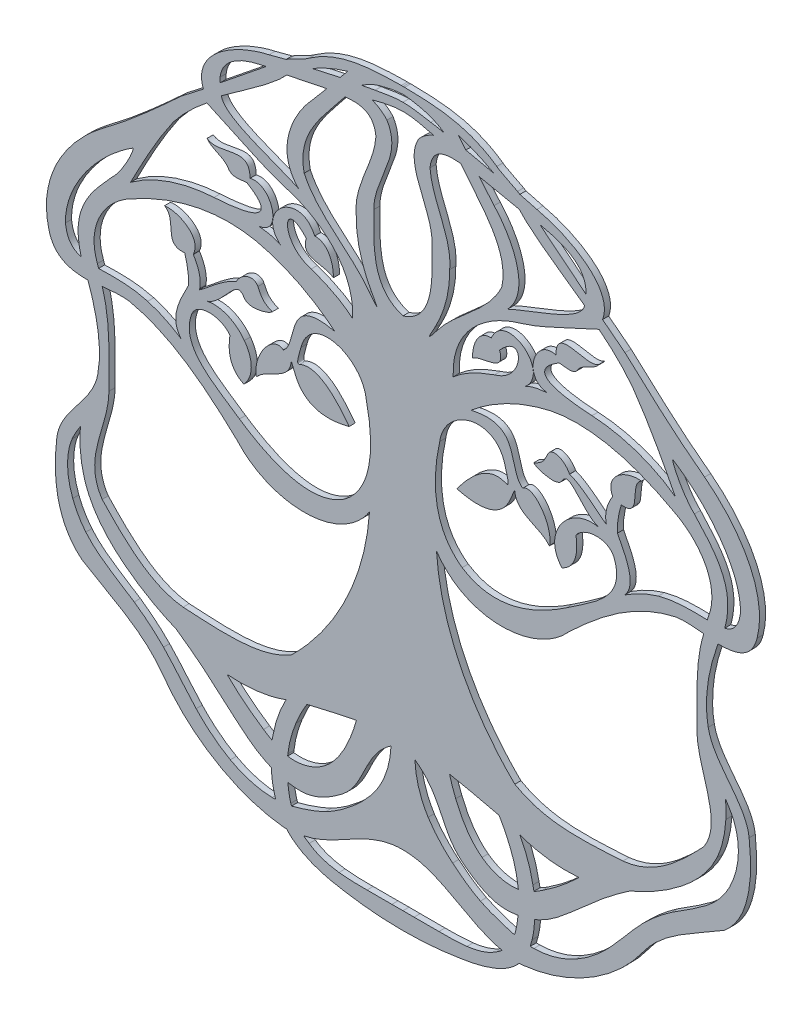
from build123d import *

# Parameters (mm, degrees)
BOSS_EXTRUDE7_DEPTH = 2.54


with BuildPart() as part:
    # Sketch2 → Boss-Extrude7 (new body)
    with BuildSketch(Plane.XY):
        with BuildLine():
            Line((152.3000002, 304.769901), (151.6257826, 304.818034))
            add(Edge.make_bspline(
                [(113.3331744, 295.5002472), (124.9781092, 303.831371), (137.6751374, 304.6500384), (151.6257826, 304.818034)],
                knots=[0, 0, 0, 0, 1, 1, 1, 1], degree=3))
            add(Edge.make_bspline(
                [(104.722295, 290.8366294), (107.5512962, 292.465125), (111.5847908, 294.1033234), (113.3331744, 295.5002472)],
                knots=[0, 0, 0, 0, 1, 1, 1, 1], degree=3))
            add(Edge.make_bspline(
                [(103.7401786, 290.2368338), (103.8863556, 290.327207), (104.3898598, 290.6452658), (104.722295, 290.8366294)],
                knots=[0, 0, 0, 0, 1, 1, 1, 1], degree=3))
            add(Edge.make_bspline(
                [(96.6659738, 288.367978), (98.9349558, 288.8485714), (101.2604274, 289.7002842), (103.7401786, 290.2368338)],
                knots=[0, 0, 0, 0, 1, 1, 1, 1], degree=3))
            add(Edge.make_bspline(
                [(69.3754518, 262.3802728), (64.5839196, 275.4394288), (83.7947524, 285.6417198), (96.6659738, 288.367978)],
                knots=[0, 0, 0, 0, 1, 1, 1, 1], degree=3))
            add(Edge.make_bspline(
                [(60.0736924, 255.1498326), (63.058421, 257.6132008), (66.2000454, 259.7648094), (69.3754518, 262.3802728)],
                knots=[0, 0, 0, 0, 1, 1, 1, 1], degree=3))
            add(Edge.make_bspline(
                [(27.0060166, 226.9131098), (38.7004052, 235.5524626), (49.4139982, 245.3115236), (60.0736924, 255.1498326)],
                knots=[0, 0, 0, 0, 1, 1, 1, 1], degree=3))
            add(Edge.make_bspline(
                [(5.198618, 179.7975576), (0.476758, 198.246746), (12.9431542, 216.1660142), (27.0060166, 226.9131098)],
                knots=[0, 0, 0, 0, 1, 1, 1, 1], degree=3))
            add(Edge.make_bspline(
                [(21.4404956, 169.6735494), (14.0928852, 169.618787), (7.3094342, 171.153836), (5.198618, 179.7975576)],
                knots=[0, 0, 0, 0, 1, 1, 1, 1], degree=3))
            add(Edge.make_bspline(
                [(25.49017, 137.6539538), (27.4821904, 148.226145), (25.11425, 159.3330316), (21.4404956, 169.6735494)],
                knots=[0, 0, 0, 0, 1, 1, 1, 1], degree=3))
            add(Edge.make_bspline(
                [(8.4785454, 106.3868586), (9.8627184, 118.17096), (23.2931716, 125.994033), (25.49017, 137.6539538)],
                knots=[0, 0, 0, 0, 1, 1, 1, 1], degree=3))
            add(Edge.make_bspline(
                [(18.9078616, 67.8699684), (7.7220826, 76.9854188), (6.926834, 93.1763694), (8.4785454, 106.3868586)],
                knots=[0, 0, 0, 0, 1, 1, 1, 1], degree=3))
            add(Edge.make_bspline(
                [(52.6722086, 43.0965102), (44.261278, 55.0397426), (30.7505354, 60.4837246), (18.9078616, 67.8699684)],
                knots=[0, 0, 0, 0, 1, 1, 1, 1], degree=3))
            add(Edge.make_bspline(
                [(102.368858, 13.5532368), (83.2085966, 15.6220668), (64.1308598, 27.03576), (52.6722086, 43.0965102)],
                knots=[0, 0, 0, 0, 1, 1, 1, 1], degree=3))
            add(Edge.make_bspline(
                [(103.9590504, 13.5029448), (103.463852, 13.5462264), (102.8532868, 13.5009382), (102.368858, 13.5532368)],
                knots=[0, 0, 0, 0, 1, 1, 1, 1], degree=3))
            add(Edge.make_bspline(
                [(114.5072132, 6.4857884), (110.491397, 8.1114138), (106.7891184, 10.2032308), (103.9590504, 13.5029448)],
                knots=[0, 0, 0, 0, 1, 1, 1, 1], degree=3))
            add(Edge.make_bspline(
                [(128.2229084, 3.042793), (123.5579444, 3.7879782), (118.8861732, 4.7131732), (114.5072132, 6.4857884)],
                knots=[0, 0, 0, 0, 1, 1, 1, 1], degree=3))
            add(Edge.make_bspline(
                [(143.3041584, 1.3230098), (138.252581, 1.6410686), (133.2211458, 2.2443694), (128.2229084, 3.042793)],
                knots=[0, 0, 0, 0, 1, 1, 1, 1], degree=3))
            add(Edge.make_bspline(
                [(152.3000002, 1.0541762), (149.358731, 1.052195), (146.2599056, 1.1369802), (143.3041584, 1.3230098)],
                knots=[0, 0, 0, 0, 1, 1, 1, 1], degree=3))
            add(Edge.make_bspline(
                [(161.2958166, 1.3230098), (158.3400948, 1.1369294), (155.2412694, 1.0524998), (152.3000002, 1.0541762)],
                knots=[0, 0, 0, 0, 1, 1, 1, 1], degree=3))
            add(Edge.make_bspline(
                [(176.3770666, 3.042793), (171.3788546, 2.2443694), (166.3474194, 1.6410686), (161.2958166, 1.3230098)],
                knots=[0, 0, 0, 0, 1, 1, 1, 1], degree=3))
            add(Edge.make_bspline(
                [(190.0927618, 6.4857884), (185.7138272, 4.7131732), (181.042056, 3.7879782), (176.3770666, 3.042793)],
                knots=[0, 0, 0, 0, 1, 1, 1, 1], degree=3))
            add(Edge.make_bspline(
                [(200.6409246, 13.5029448), (197.810882, 10.2032308), (194.1086034, 8.1114138), (190.0927618, 6.4857884)],
                knots=[0, 0, 0, 0, 1, 1, 1, 1], degree=3))
            add(Edge.make_bspline(
                [(202.2311424, 13.5532368), (201.7466882, 13.5009382), (201.136123, 13.5462264), (200.6409246, 13.5029448)],
                knots=[0, 0, 0, 0, 1, 1, 1, 1], degree=3))
            add(Edge.make_bspline(
                [(251.9277664, 43.0965102), (240.4691406, 27.03576), (221.3914038, 15.6220668), (202.2311424, 13.5532368)],
                knots=[0, 0, 0, 0, 1, 1, 1, 1], degree=3))
            add(Edge.make_bspline(
                [(285.6921388, 67.8699684), (273.8494396, 60.4837246), (260.338697, 55.0397426), (251.9277664, 43.0965102)],
                knots=[0, 0, 0, 0, 1, 1, 1, 1], degree=3))
            add(Edge.make_bspline(
                [(296.1214296, 106.3868586), (297.6731664, 93.1763694), (296.8778924, 76.9854188), (285.6921388, 67.8699684)],
                knots=[0, 0, 0, 0, 1, 1, 1, 1], degree=3))
            add(Edge.make_bspline(
                [(279.1098304, 137.6539538), (281.3068034, 125.994033), (294.737282, 118.17096), (296.1214296, 106.3868586)],
                knots=[0, 0, 0, 0, 1, 1, 1, 1], degree=3))
            add(Edge.make_bspline(
                [(283.1594794, 169.6735494), (279.4857504, 159.3330316), (277.11781, 148.226145), (279.1098304, 137.6539538)],
                knots=[0, 0, 0, 0, 1, 1, 1, 1], degree=3))
            add(Edge.make_bspline(
                [(299.4013824, 179.7975576), (297.2905408, 171.153836), (290.5070898, 169.618787), (283.1594794, 169.6735494)],
                knots=[0, 0, 0, 0, 1, 1, 1, 1], degree=3))
            add(Edge.make_bspline(
                [(277.5939838, 226.9131098), (291.6568208, 216.1660142), (304.1232424, 198.246746), (299.4013824, 179.7975576)],
                knots=[0, 0, 0, 0, 1, 1, 1, 1], degree=3))
            add(Edge.make_bspline(
                [(244.526308, 255.1498326), (255.1859768, 245.3115236), (265.8995698, 235.5524626), (277.5939838, 226.9131098)],
                knots=[0, 0, 0, 0, 1, 1, 1, 1], degree=3))
            add(Edge.make_bspline(
                [(235.2245232, 262.3802728), (238.399955, 259.7648094), (241.541554, 257.6132008), (244.526308, 255.1498326)],
                knots=[0, 0, 0, 0, 1, 1, 1, 1], degree=3))
            add(Edge.make_bspline(
                [(207.9340012, 288.367978), (220.8052226, 285.6417198), (240.0160554, 275.4394288), (235.2245232, 262.3802728)],
                knots=[0, 0, 0, 0, 1, 1, 1, 1], degree=3))
            add(Edge.make_bspline(
                [(200.8597964, 290.2368338), (203.339573, 289.7002842), (205.6650192, 288.8485714), (207.9340012, 288.367978)],
                knots=[0, 0, 0, 0, 1, 1, 1, 1], degree=3))
            add(Edge.make_bspline(
                [(199.87768, 290.8366294), (200.2101406, 290.6452658), (200.7136448, 290.327207), (200.8597964, 290.2368338)],
                knots=[0, 0, 0, 0, 1, 1, 1, 1], degree=3))
            add(Edge.make_bspline(
                [(191.2668006, 295.5002472), (193.0151842, 294.1033234), (197.0487042, 292.465125), (199.87768, 290.8366294)],
                knots=[0, 0, 0, 0, 1, 1, 1, 1], degree=3))
            add(Edge.make_bspline(
                [(152.9741924, 304.818034), (166.924863, 304.6500384), (179.6218658, 303.831371), (191.2668006, 295.5002472)],
                knots=[0, 0, 0, 0, 1, 1, 1, 1], degree=3))
            Line((152.9741924, 304.818034), (152.3000002, 304.769901))
        make_face()
        with BuildLine():
            add(Edge.make_bspline(
                [(18.354675, 115.5237212), (18.057495, 113.2715032), (18.0132228, 110.7047316), (18.1562502, 108.1484248)],
                knots=[0, 0, 0, 0, 1, 1, 1, 1], degree=3))
            add(Edge.make_bspline(
                [(18.1562502, 108.1484248), (18.456783, 102.7768836), (19.6001894, 97.4201506), (21.8604084, 92.5380166)],
                knots=[0, 0, 0, 0, 1, 1, 1, 1], degree=3))
            add(Edge.make_bspline(
                [(21.8604084, 92.5380166), (25.0727972, 85.59927), (30.4308256, 79.838423), (36.4125002, 75.0755166)],
                knots=[0, 0, 0, 0, 1, 1, 1, 1], degree=3))
            add(Edge.make_bspline(
                [(36.4125002, 75.0755166), (42.9606964, 69.8615062), (50.325528, 65.7178772), (58.0619108, 62.4519198)],
                knots=[0, 0, 0, 0, 1, 1, 1, 1], degree=3))
            add(Edge.make_bspline(
                [(58.0619108, 62.4519198), (61.9791496, 59.781821), (65.7581108, 56.9600588), (69.4034426, 53.9750762)],
                knots=[0, 0, 0, 0, 1, 1, 1, 1], degree=3))
            add(Edge.make_bspline(
                [(69.4034426, 53.9750762), (73.9699562, 50.235739), (78.3226272, 46.2440528), (82.7802764, 42.375582)],
                knots=[0, 0, 0, 0, 1, 1, 1, 1], degree=3))
            add(Edge.make_bspline(
                [(82.7802764, 42.375582), (86.6647746, 39.0045194), (90.6804892, 35.6931722), (95.3066166, 33.4454246)],
                knots=[0, 0, 0, 0, 1, 1, 1, 1], degree=3))
            add(Edge.make_bspline(
                [(95.3066166, 33.4454246), (96.016953, 33.1002894), (96.7441042, 32.757872), (97.582355, 32.4747128)],
                knots=[0, 0, 0, 0, 1, 1, 1, 1], degree=3))
            add(Edge.make_bspline(
                [(97.582355, 32.4747128), (97.6805768, 29.7320462), (98.0484958, 27.128597), (98.6556828, 24.6063262)],
                knots=[0, 0, 0, 0, 1, 1, 1, 1], degree=3))
            add(Edge.make_bspline(
                [(98.6556828, 24.6063262), (98.8530916, 23.7862364), (99.1465886, 22.8141276), (99.431475, 21.844)],
                knots=[0, 0, 0, 0, 1, 1, 1, 1], degree=3))
            add(Edge.make_bspline(
                [(99.431475, 21.844), (98.9610162, 21.8112086), (98.4074994, 21.82241), (97.9281252, 21.8283028)],
                knots=[0, 0, 0, 0, 1, 1, 1, 1], degree=3))
            add(Edge.make_bspline(
                [(97.9281252, 21.8283028), (91.8599128, 21.9005912), (85.8884998, 23.7594902), (80.5721274, 26.6860528)],
                knots=[0, 0, 0, 0, 1, 1, 1, 1], degree=3))
            add(Edge.make_bspline(
                [(80.5721274, 26.6860528), (75.2557804, 29.6124884), (70.565899, 33.5817972), (66.3867608, 37.9821694)],
                knots=[0, 0, 0, 0, 1, 1, 1, 1], degree=3))
            add(Edge.make_bspline(
                [(66.3867608, 37.9821694), (61.6856272, 42.9321722), (57.5977512, 48.4420672), (52.8260564, 53.324125)],
                knots=[0, 0, 0, 0, 1, 1, 1, 1], degree=3))
            add(Edge.make_bspline(
                [(52.8260564, 53.324125), (49.1221268, 57.1137288), (45.0197474, 60.508515), (40.645842, 63.5000254)],
                knots=[0, 0, 0, 0, 1, 1, 1, 1], degree=3))
            add(Edge.make_bspline(
                [(40.645842, 63.5000254), (33.7019138, 68.2492666), (25.9219954, 72.1175088), (20.5375002, 78.5812754)],
                knots=[0, 0, 0, 0, 1, 1, 1, 1], degree=3))
            add(Edge.make_bspline(
                [(20.5375002, 78.5812754), (18.2128668, 81.3718464), (16.4063172, 84.5798918), (15.1135334, 87.9739922)],
                knots=[0, 0, 0, 0, 1, 1, 1, 1], degree=3))
            add(Edge.make_bspline(
                [(15.1135334, 87.9739922), (12.5246384, 94.7710068), (12.0594628, 102.5557512), (14.848967, 109.272959)],
                knots=[0, 0, 0, 0, 1, 1, 1, 1], degree=3))
            add(Edge.make_bspline(
                [(14.848967, 109.272959), (15.7396942, 111.4178366), (16.9474388, 113.4307612), (18.354675, 115.5237212)],
                knots=[0, 0, 0, 0, 1, 1, 1, 1], degree=3))
        make_face(mode=Mode.SUBTRACT)
        with BuildLine():
            add(Edge.make_bspline(
                [(97.8954354, 42.4318684), (96.5632562, 43.0445672), (95.5440304, 43.767883), (94.3796944, 44.5275208)],
                knots=[0, 0, 0, 0, 1, 1, 1, 1], degree=3))
            add(Edge.make_bspline(
                [(94.3796944, 44.5275208), (88.9436372, 48.0741482), (83.8558394, 52.1542772), (79.1861764, 56.7423554)],
                knots=[0, 0, 0, 0, 1, 1, 1, 1], degree=3))
            add(Edge.make_bspline(
                [(79.1861764, 56.7423554), (87.3859568, 55.9963828), (95.9710552, 56.9997082), (103.730171, 59.8480134)],
                knots=[0, 0, 0, 0, 1, 1, 1, 1], degree=3))
            add(Edge.make_bspline(
                [(103.730171, 59.8480134), (101.125401, 55.0696892), (99.292791, 49.8715538), (98.324924, 44.5161416)],
                knots=[0, 0, 0, 0, 1, 1, 1, 1], degree=3))
            add(Edge.make_bspline(
                [(98.324924, 44.5161416), (98.202877, 43.8408826), (98.0945206, 43.1632106), (97.8954354, 42.4318684)],
                knots=[0, 0, 0, 0, 1, 1, 1, 1], degree=3))
        make_face(mode=Mode.SUBTRACT)
        with BuildLine():
            add(Edge.make_bspline(
                [(106.009948, 22.7377752), (105.842054, 23.0519986), (105.757218, 23.4291886), (105.6985948, 23.6200696)],
                knots=[0, 0, 0, 0, 1, 1, 1, 1], degree=3))
            add(Edge.make_bspline(
                [(105.6985948, 23.6200696), (105.0734246, 25.6547874), (104.7168848, 28.3078174), (104.4651962, 30.4702464)],
                knots=[0, 0, 0, 0, 1, 1, 1, 1], degree=3))
            add(Edge.make_bspline(
                [(104.4651962, 30.4702464), (106.8695856, 30.0801024), (109.4911196, 29.8649644), (111.938689, 30.193996)],
                knots=[0, 0, 0, 0, 1, 1, 1, 1], degree=3))
            add(Edge.make_bspline(
                [(111.938689, 30.193996), (116.2521424, 30.7738526), (120.2232546, 32.8544428), (123.846209, 35.2661474)],
                knots=[0, 0, 0, 0, 1, 1, 1, 1], degree=3))
            add(Edge.make_bspline(
                [(123.846209, 35.2661474), (126.3036844, 36.9020344), (128.668399, 38.7238494), (130.5814, 40.972359)],
                knots=[0, 0, 0, 0, 1, 1, 1, 1], degree=3))
            add(Edge.make_bspline(
                [(130.5814, 40.972359), (133.5668906, 44.4814452), (135.309737, 48.8453684), (137.4101392, 52.9460206)],
                knots=[0, 0, 0, 0, 1, 1, 1, 1], degree=3))
            add(Edge.make_bspline(
                [(137.4101392, 52.9460206), (138.8113556, 55.6816514), (140.4000748, 58.3422252), (142.414752, 60.6634296)],
                knots=[0, 0, 0, 0, 1, 1, 1, 1], degree=3))
            add(Edge.make_bspline(
                [(142.414752, 60.6634296), (143.859377, 62.3278408), (145.5163206, 63.8077718), (147.3326746, 65.056004)],
                knots=[0, 0, 0, 0, 1, 1, 1, 1], degree=3))
            add(Edge.make_bspline(
                [(147.3326746, 65.056004), (147.1120502, 58.728356), (145.2004208, 52.4674592), (141.8489162, 47.0957656)],
                knots=[0, 0, 0, 0, 1, 1, 1, 1], degree=3))
            add(Edge.make_bspline(
                [(141.8489162, 47.0957656), (139.1437654, 42.760011), (135.5484462, 39.0376664), (131.6624748, 35.7186738)],
                knots=[0, 0, 0, 0, 1, 1, 1, 1], degree=3))
            add(Edge.make_bspline(
                [(131.6624748, 35.7186738), (128.111377, 32.685736), (124.2859084, 29.9557694), (120.1530744, 27.7811738)],
                knots=[0, 0, 0, 0, 1, 1, 1, 1], degree=3))
            add(Edge.make_bspline(
                [(120.1530744, 27.7811738), (116.9084784, 26.0739636), (109.6428592, 23.6002322), (106.009948, 22.7377752)],
                knots=[0, 0, 0, 0, 1, 1, 1, 1], degree=3))
        make_face(mode=Mode.SUBTRACT)
        with BuildLine():
            add(Edge.make_bspline(
                [(107.850051, 53.5074876), (109.1175364, 56.6350404), (110.6428318, 59.6580976), (112.4053632, 62.5358922)],
                knots=[0, 0, 0, 0, 1, 1, 1, 1], degree=3))
            Line((112.4053632, 62.5358922), (113.2709952, 62.7419116))
            add(Edge.make_bspline(
                [(113.2709952, 62.7419116), (119.8109364, 64.2984998), (126.3656858, 65.7989032), (132.966714, 67.0716718)],
                knots=[0, 0, 0, 0, 1, 1, 1, 1], degree=3))
            add(Edge.make_bspline(
                [(132.966714, 67.0716718), (132.2555902, 64.4994138), (131.3962066, 61.968126), (130.3942782, 59.4945978)],
                knots=[0, 0, 0, 0, 1, 1, 1, 1], degree=3))
            add(Edge.make_bspline(
                [(130.3942782, 59.4945978), (127.9774428, 53.5280616), (124.5923086, 47.7447102), (119.4495706, 43.8726834)],
                knots=[0, 0, 0, 0, 1, 1, 1, 1], degree=3))
            add(Edge.make_bspline(
                [(119.4495706, 43.8726834), (115.3070084, 40.7536904), (109.723555, 39.047547), (104.3723084, 39.9071338)],
                knots=[0, 0, 0, 0, 1, 1, 1, 1], degree=3))
            add(Edge.make_bspline(
                [(104.3723084, 39.9071338), (104.3885136, 40.1093432), (104.458008, 40.5702516), (104.4824682, 40.7854404)],
                knots=[0, 0, 0, 0, 1, 1, 1, 1], degree=3))
            add(Edge.make_bspline(
                [(104.4824682, 40.7854404), (104.9806384, 45.1574408), (106.1973492, 49.4293652), (107.850051, 53.5074876)],
                knots=[0, 0, 0, 0, 1, 1, 1, 1], degree=3))
        make_face(mode=Mode.SUBTRACT)
        with BuildLine():
            add(Edge.make_bspline(
                [(83.376643, 143.0549844), (97.3135976, 127.2660396), (126.306072, 126.297944), (138.3929668, 144.76476)],
                knots=[0, 0, 0, 0, 1, 1, 1, 1], degree=3))
            add(Edge.make_bspline(
                [(138.3929668, 144.76476), (136.7141284, 119.0567342), (124.1429064, 94.7807604), (105.8412412, 76.9863078)],
                knots=[0, 0, 0, 0, 1, 1, 1, 1], degree=3))
            add(Edge.make_bspline(
                [(105.8412412, 76.9863078), (92.5807394, 69.194045), (75.773661, 71.0296776), (60.9563424, 71.7832702)],
                knots=[0, 0, 0, 0, 1, 1, 1, 1], degree=3))
            add(Edge.make_bspline(
                [(60.9563424, 71.7832702), (47.0886028, 73.2324672), (36.4635542, 84.1426562), (27.3496278, 93.7396906)],
                knots=[0, 0, 0, 0, 1, 1, 1, 1], degree=3))
            add(Edge.make_bspline(
                [(27.3496278, 93.7396906), (18.9888368, 106.168952), (30.1726854, 120.5622176), (30.1207424, 134.020941)],
                knots=[0, 0, 0, 0, 1, 1, 1, 1], degree=3))
            add(Edge.make_bspline(
                [(30.1207424, 134.020941), (30.073279315, 146.16970787), (31.04681622, 158.395614173), (27.337063184, 170.361091545)],
                knots=[0, 0, 0, 0, 1, 1, 1, 1], degree=3))
            add(Edge.make_bspline(
                [(27.337063184, 170.361091545), (31.309939116, 170.799431751), (34.96997019, 171.096426337), (38.5956302, 170.6815484)],
                knots=[0, 0, 0, 0, 1, 1, 1, 1], degree=3))
            add(Edge.make_bspline(
                [(38.5956302, 170.6815484), (56.2045104, 166.937563), (70.5685914, 155.1577034), (83.376643, 143.0549844)],
                knots=[0, 0, 0, 0, 1, 1, 1, 1], degree=3))
        make_face(mode=Mode.SUBTRACT)
        with BuildLine():
            Line((156.8944284, 8.2281014), (152.3000002, 8.2514948))
            Line((152.3000002, 8.2514948), (147.7055466, 8.2281014))
            add(Edge.make_bspline(
                [(147.7055466, 8.2281014), (144.258157, 8.2310986), (140.8107928, 8.2331052), (137.3634032, 8.2320892)],
                knots=[0, 0, 0, 0, 1, 1, 1, 1], degree=3))
            add(Edge.make_bspline(
                [(137.3634032, 8.2320892), (133.475603, 8.231505), (129.5762966, 8.229092), (125.7171222, 8.6998302)],
                knots=[0, 0, 0, 0, 1, 1, 1, 1], degree=3))
            add(Edge.make_bspline(
                [(125.7171222, 8.6998302), (121.3366382, 9.2339922), (116.9357834, 10.4226614), (113.3225064, 12.9560828)],
                knots=[0, 0, 0, 0, 1, 1, 1, 1], degree=3))
            add(Edge.make_bspline(
                [(113.3225064, 12.9560828), (112.5169708, 13.5208772), (111.7219254, 13.9573254), (111.1132652, 14.6004026)],
                knots=[0, 0, 0, 0, 1, 1, 1, 1], degree=3))
            add(Edge.make_bspline(
                [(111.1132652, 14.6004026), (125.1193586, 17.292447), (136.7410778, 30.2631348), (152.3000002, 30.160595)],
                knots=[0, 0, 0, 0, 1, 1, 1, 1], degree=3))
            add(Edge.make_bspline(
                [(152.3000002, 30.160595), (167.8589226, 30.2631348), (179.4806164, 17.292447), (193.4867352, 14.6004026)],
                knots=[0, 0, 0, 0, 1, 1, 1, 1], degree=3))
            add(Edge.make_bspline(
                [(193.4867352, 14.6004026), (192.878075, 13.9573254), (192.0830296, 13.5208772), (191.277494, 12.9560828)],
                knots=[0, 0, 0, 0, 1, 1, 1, 1], degree=3))
            add(Edge.make_bspline(
                [(191.277494, 12.9560828), (187.6641916, 10.4226614), (183.2633622, 9.2339922), (178.8828782, 8.6998302)],
                knots=[0, 0, 0, 0, 1, 1, 1, 1], degree=3))
            add(Edge.make_bspline(
                [(178.8828782, 8.6998302), (175.0236784, 8.229092), (171.124372, 8.231505), (167.2365972, 8.2320892)],
                knots=[0, 0, 0, 0, 1, 1, 1, 1], degree=3))
            add(Edge.make_bspline(
                [(167.2365972, 8.2320892), (163.7892076, 8.2331052), (160.341818, 8.2310986), (156.8944284, 8.2281014)],
                knots=[0, 0, 0, 0, 1, 1, 1, 1], degree=3))
        make_face(mode=Mode.SUBTRACT)
        with BuildLine():
            add(Edge.make_bspline(
                [(198.9013802, 23.6200696), (199.5265758, 25.6547874), (199.8831156, 28.3078174), (200.1348042, 30.4702464)],
                knots=[0, 0, 0, 0, 1, 1, 1, 1], degree=3))
            add(Edge.make_bspline(
                [(198.5900524, 22.7377752), (198.757921, 23.0519986), (198.842757, 23.4291886), (198.9013802, 23.6200696)],
                knots=[0, 0, 0, 0, 1, 1, 1, 1], degree=3))
            add(Edge.make_bspline(
                [(184.4469006, 27.7811738), (187.6914966, 26.0739636), (194.9571412, 23.6002322), (198.5900524, 22.7377752)],
                knots=[0, 0, 0, 0, 1, 1, 1, 1], degree=3))
            add(Edge.make_bspline(
                [(172.9375256, 35.7186738), (176.4886234, 32.685736), (180.314092, 29.9557694), (184.4469006, 27.7811738)],
                knots=[0, 0, 0, 0, 1, 1, 1, 1], degree=3))
            add(Edge.make_bspline(
                [(162.7510588, 47.0957656), (165.4562096, 42.760011), (169.0515288, 39.0376664), (172.9375256, 35.7186738)],
                knots=[0, 0, 0, 0, 1, 1, 1, 1], degree=3))
            add(Edge.make_bspline(
                [(157.2673258, 65.056004), (157.4879502, 58.728356), (159.3995542, 52.4674592), (162.7510588, 47.0957656)],
                knots=[0, 0, 0, 0, 1, 1, 1, 1], degree=3))
            add(Edge.make_bspline(
                [(162.185223, 60.6634296), (160.740598, 62.3278408), (159.0836798, 63.8077718), (157.2673258, 65.056004)],
                knots=[0, 0, 0, 0, 1, 1, 1, 1], degree=3))
            add(Edge.make_bspline(
                [(167.1898612, 52.9460206), (165.7886448, 55.6816514), (164.1999256, 58.3422252), (162.185223, 60.6634296)],
                knots=[0, 0, 0, 0, 1, 1, 1, 1], degree=3))
            add(Edge.make_bspline(
                [(174.0186004, 40.972359), (171.0330844, 44.4814452), (169.290238, 48.8453684), (167.1898612, 52.9460206)],
                knots=[0, 0, 0, 0, 1, 1, 1, 1], degree=3))
            add(Edge.make_bspline(
                [(180.753766, 35.2661474), (178.2962906, 36.9020344), (175.9316014, 38.7238494), (174.0186004, 40.972359)],
                knots=[0, 0, 0, 0, 1, 1, 1, 1], degree=3))
            add(Edge.make_bspline(
                [(192.6613114, 30.193996), (188.3478326, 30.7738526), (184.3767458, 32.8544428), (180.753766, 35.2661474)],
                knots=[0, 0, 0, 0, 1, 1, 1, 1], degree=3))
            add(Edge.make_bspline(
                [(200.1348042, 30.4702464), (197.7303894, 30.0801024), (195.1088554, 29.8649644), (192.6613114, 30.193996)],
                knots=[0, 0, 0, 0, 1, 1, 1, 1], degree=3))
        make_face(mode=Mode.SUBTRACT)
        with BuildLine():
            Line((191.3290052, 62.7419116), (192.1946118, 62.5358922))
            add(Edge.make_bspline(
                [(196.749924, 53.5074876), (195.482464, 56.6350404), (193.9571686, 59.6580976), (192.1946118, 62.5358922)],
                knots=[0, 0, 0, 0, 1, 1, 1, 1], degree=3))
            add(Edge.make_bspline(
                [(200.1175322, 40.7854404), (199.619362, 45.1574408), (198.4026512, 49.4293652), (196.749924, 53.5074876)],
                knots=[0, 0, 0, 0, 1, 1, 1, 1], degree=3))
            add(Edge.make_bspline(
                [(200.227692, 39.9071338), (200.2114868, 40.1093432), (200.1419924, 40.5702516), (200.1175322, 40.7854404)],
                knots=[0, 0, 0, 0, 1, 1, 1, 1], degree=3))
            add(Edge.make_bspline(
                [(185.1504044, 43.8726834), (189.292992, 40.7536904), (194.8764454, 39.047547), (200.227692, 39.9071338)],
                knots=[0, 0, 0, 0, 1, 1, 1, 1], degree=3))
            add(Edge.make_bspline(
                [(174.2057222, 59.4945978), (176.6225322, 53.5280616), (180.0076664, 47.7447102), (185.1504044, 43.8726834)],
                knots=[0, 0, 0, 0, 1, 1, 1, 1], degree=3))
            add(Edge.make_bspline(
                [(171.633261, 67.0716718), (172.3444102, 64.4994138), (173.2037938, 61.968126), (174.2057222, 59.4945978)],
                knots=[0, 0, 0, 0, 1, 1, 1, 1], degree=3))
            add(Edge.make_bspline(
                [(191.3290052, 62.7419116), (184.789064, 64.2984998), (178.2342892, 65.7989032), (171.633261, 67.0716718)],
                knots=[0, 0, 0, 0, 1, 1, 1, 1], degree=3))
        make_face(mode=Mode.SUBTRACT)
        with BuildLine():
            add(Edge.make_bspline(
                [(210.2202806, 44.5275208), (215.6563632, 48.0741482), (220.7441356, 52.1542772), (225.413824, 56.7423554)],
                knots=[0, 0, 0, 0, 1, 1, 1, 1], degree=3))
            add(Edge.make_bspline(
                [(206.704565, 42.4318684), (208.0367442, 43.0445672), (209.05597, 43.767883), (210.2202806, 44.5275208)],
                knots=[0, 0, 0, 0, 1, 1, 1, 1], degree=3))
            add(Edge.make_bspline(
                [(206.2750764, 44.5161416), (206.3971234, 43.8408826), (206.5054544, 43.1632106), (206.704565, 42.4318684)],
                knots=[0, 0, 0, 0, 1, 1, 1, 1], degree=3))
            add(Edge.make_bspline(
                [(200.869804, 59.8480134), (203.474574, 55.0696892), (205.307184, 49.8715538), (206.2750764, 44.5161416)],
                knots=[0, 0, 0, 0, 1, 1, 1, 1], degree=3))
            add(Edge.make_bspline(
                [(225.413824, 56.7423554), (217.2140436, 55.9963828), (208.6289452, 56.9997082), (200.869804, 59.8480134)],
                knots=[0, 0, 0, 0, 1, 1, 1, 1], degree=3))
        make_face(mode=Mode.SUBTRACT)
        with BuildLine():
            add(Edge.make_bspline(
                [(286.4437502, 108.1484248), (286.1432174, 102.7768836), (284.999811, 97.4201506), (282.7395666, 92.5380166)],
                knots=[0, 0, 0, 0, 1, 1, 1, 1], degree=3))
            add(Edge.make_bspline(
                [(286.2453, 115.5237212), (286.5425054, 113.2715032), (286.5867522, 110.7047316), (286.4437502, 108.1484248)],
                knots=[0, 0, 0, 0, 1, 1, 1, 1], degree=3))
            add(Edge.make_bspline(
                [(289.7510334, 109.272959), (288.8603062, 111.4178366), (287.6525616, 113.4307612), (286.2453, 115.5237212)],
                knots=[0, 0, 0, 0, 1, 1, 1, 1], degree=3))
            add(Edge.make_bspline(
                [(289.4864416, 87.9739922), (292.0753366, 94.7710068), (292.5405376, 102.5557512), (289.7510334, 109.272959)],
                knots=[0, 0, 0, 0, 1, 1, 1, 1], degree=3))
            add(Edge.make_bspline(
                [(284.0625002, 78.5812754), (286.3871082, 81.3718464), (288.1936832, 84.5798918), (289.4864416, 87.9739922)],
                knots=[0, 0, 0, 0, 1, 1, 1, 1], degree=3))
            add(Edge.make_bspline(
                [(263.9541584, 63.5000254), (270.8980612, 68.2492666), (278.6779796, 72.1175088), (284.0625002, 78.5812754)],
                knots=[0, 0, 0, 0, 1, 1, 1, 1], degree=3))
            add(Edge.make_bspline(
                [(251.7739186, 53.324125), (255.4778736, 57.1137288), (259.5802276, 60.508515), (263.9541584, 63.5000254)],
                knots=[0, 0, 0, 0, 1, 1, 1, 1], degree=3))
            add(Edge.make_bspline(
                [(238.2132142, 37.9821694), (242.9143732, 42.9321722), (247.0022492, 48.4420672), (251.7739186, 53.324125)],
                knots=[0, 0, 0, 0, 1, 1, 1, 1], degree=3))
            add(Edge.make_bspline(
                [(224.0278476, 26.6860528), (229.34422, 29.6124884), (234.034076, 33.5817972), (238.2132142, 37.9821694)],
                knots=[0, 0, 0, 0, 1, 1, 1, 1], degree=3))
            add(Edge.make_bspline(
                [(206.6718752, 21.8283028), (212.7400876, 21.9005912), (218.7115006, 23.7594902), (224.0278476, 26.6860528)],
                knots=[0, 0, 0, 0, 1, 1, 1, 1], degree=3))
            add(Edge.make_bspline(
                [(205.1685254, 21.844), (205.6389842, 21.8112086), (206.1924756, 21.82241), (206.6718752, 21.8283028)],
                knots=[0, 0, 0, 0, 1, 1, 1, 1], degree=3))
            add(Edge.make_bspline(
                [(205.9443176, 24.6063262), (205.7468834, 23.7862364), (205.4534118, 22.8141276), (205.1685254, 21.844)],
                knots=[0, 0, 0, 0, 1, 1, 1, 1], degree=3))
            add(Edge.make_bspline(
                [(207.0176454, 32.4747128), (206.919449, 29.7320462), (206.5515046, 27.128597), (205.9443176, 24.6063262)],
                knots=[0, 0, 0, 0, 1, 1, 1, 1], degree=3))
            add(Edge.make_bspline(
                [(209.2933838, 33.4454246), (208.583022, 33.1002894), (207.8558962, 32.757872), (207.0176454, 32.4747128)],
                knots=[0, 0, 0, 0, 1, 1, 1, 1], degree=3))
            add(Edge.make_bspline(
                [(221.819724, 42.375582), (217.9352004, 39.0045194), (213.9195112, 35.6931722), (209.2933838, 33.4454246)],
                knots=[0, 0, 0, 0, 1, 1, 1, 1], degree=3))
            add(Edge.make_bspline(
                [(235.1965578, 53.9750762), (230.6300188, 50.235739), (226.2773732, 46.2440528), (221.819724, 42.375582)],
                knots=[0, 0, 0, 0, 1, 1, 1, 1], degree=3))
            add(Edge.make_bspline(
                [(246.5380642, 62.4519198), (242.6208254, 59.781821), (238.8418642, 56.9600588), (235.1965578, 53.9750762)],
                knots=[0, 0, 0, 0, 1, 1, 1, 1], degree=3))
            add(Edge.make_bspline(
                [(268.1875002, 75.0755166), (261.639304, 69.8615062), (254.274447, 65.7178772), (246.5380642, 62.4519198)],
                knots=[0, 0, 0, 0, 1, 1, 1, 1], degree=3))
            add(Edge.make_bspline(
                [(282.7395666, 92.5380166), (279.5272032, 85.59927), (274.1691494, 79.838423), (268.1875002, 75.0755166)],
                knots=[0, 0, 0, 0, 1, 1, 1, 1], degree=3))
        make_face(mode=Mode.SUBTRACT)
        with BuildLine():
            add(Edge.make_bspline(
                [(166.2070082, 144.7647854), (167.8858466, 119.0567596), (180.457094, 94.7808112), (198.7587592, 76.9863332)],
                knots=[0, 0, 0, 0, 1, 1, 1, 1], degree=3))
            add(Edge.make_bspline(
                [(221.223332, 143.0550098), (207.286352, 127.266065), (178.293903, 126.2979694), (166.2070082, 144.7647854)],
                knots=[0, 0, 0, 0, 1, 1, 1, 1], degree=3))
            add(Edge.make_bspline(
                [(266.0043194, 170.6815738), (248.3954646, 166.9375884), (234.0313582, 155.1577288), (221.223332, 143.0550098)],
                knots=[0, 0, 0, 0, 1, 1, 1, 1], degree=3))
            add(Edge.make_bspline(
                [(277.26288667, 170.361144271), (273.290010464, 170.799458398), (269.630004738, 171.096452158), (266.0043194, 170.6815738)],
                knots=[0, 0, 0, 0, 1, 1, 1, 1], degree=3))
            add(Edge.make_bspline(
                [(274.4792326, 134.0209664), (274.52673808, 146.169758701), (273.553167312, 158.395638931), (277.26288667, 170.361144271)],
                knots=[0, 0, 0, 0, 1, 1, 1, 1], degree=3))
            add(Edge.make_bspline(
                [(277.2503726, 93.739716), (285.6111382, 106.1689774), (274.427315, 120.562243), (274.4792326, 134.0209664)],
                knots=[0, 0, 0, 0, 1, 1, 1, 1], degree=3))
            add(Edge.make_bspline(
                [(243.643658, 71.783321), (257.5113976, 73.2324926), (268.1364462, 84.1426816), (277.2503726, 93.739716)],
                knots=[0, 0, 0, 0, 1, 1, 1, 1], degree=3))
            add(Edge.make_bspline(
                [(198.7587592, 76.9863332), (212.0192356, 69.1940704), (228.826314, 71.029703), (243.643658, 71.783321)],
                knots=[0, 0, 0, 0, 1, 1, 1, 1], degree=3))
        make_face(mode=Mode.SUBTRACT)
        with BuildLine():
            add(Edge.make_bspline(
                [(18.6255914, 176.7102892), (15.1929592, 177.503709), (12.7536194, 179.9667724), (12.0828054, 185.587259)],
                knots=[0, 0, 0, 0, 1, 1, 1, 1], degree=3))
            add(Edge.make_bspline(
                [(12.0828054, 185.587259), (11.7558312, 200.4537266), (26.0775196, 217.7236184), (39.8701514, 226.368864)],
                knots=[0, 0, 0, 0, 1, 1, 1, 1], degree=3))
            add(Edge.make_bspline(
                [(39.8701514, 226.368864), (41.6172396, 228.1060462), (36.7474246, 216.6331202), (31.2382916, 211.5411314)],
                knots=[0, 0, 0, 0, 1, 1, 1, 1], degree=3))
            add(Edge.make_bspline(
                [(31.2382916, 211.5411314), (21.5263222, 201.0771442), (14.3143478, 192.3624804), (18.6255914, 176.7102892)],
                knots=[0, 0, 0, 0, 1, 1, 1, 1], degree=3))
        make_face(mode=Mode.SUBTRACT)
        with BuildLine():
            add(Edge.make_bspline(
                [(96.526731, 217.2945616), (106.6040032, 214.3434626), (115.9871188, 209.1658504), (124.0466912, 202.456669)],
                knots=[0, 0, 0, 0, 1, 1, 1, 1], degree=3))
            Line((124.0466912, 202.456669), (123.876181, 202.500738))
            add(Edge.make_bspline(
                [(123.876181, 202.500738), (102.8617196, 207.2095932), (109.0778362, 189.8911874), (102.5828784, 185.1128124)],
                knots=[0, 0, 0, 0, 1, 1, 1, 1], degree=3))
            add(Edge.make_bspline(
                [(102.5828784, 185.1128124), (98.4979996, 188.7463078), (90.1010644, 178.3425694), (91.32062, 170.1459894)],
                knots=[0, 0, 0, 0, 1, 1, 1, 1], degree=3))
            Line((91.32062, 170.1459894), (91.4600152, 169.8813976))
            add(Edge.make_bspline(
                [(91.4600152, 169.8813976), (95.482537, 174.8632774), (105.0197798, 174.7205802), (105.8644314, 182.452645)],
                knots=[0, 0, 0, 0, 1, 1, 1, 1], degree=3))
            Line((105.8644314, 182.452645), (105.9481244, 182.5182532))
            add(Edge.make_bspline(
                [(105.9481244, 182.5182532), (107.3696354, 180.8371796), (108.6578218, 165.9256524), (129.2501098, 171.0908948)],
                knots=[0, 0, 0, 0, 1, 1, 1, 1], degree=3))
            Line((129.2501098, 171.0908948), (129.9282898, 171.2663072))
            add(Edge.make_bspline(
                [(129.9282898, 171.2663072), (118.3183054, 187.2047818), (111.5061778, 184.15), (109.345603, 183.3189882)],
                knots=[0, 0, 0, 0, 1, 1, 1, 1], degree=3))
            add(Edge.make_bspline(
                [(109.345603, 183.3189882), (107.8131702, 182.7295812), (108.828713, 185.5642212), (109.8908394, 189.6793768)],
                knots=[0, 0, 0, 0, 1, 1, 1, 1], degree=3))
            add(Edge.make_bspline(
                [(109.8908394, 189.6793768), (114.0597414, 205.4697948), (135.176768, 198.7622898), (137.0165408, 184.7176392)],
                knots=[0, 0, 0, 0, 1, 1, 1, 1], degree=3))
            add(Edge.make_bspline(
                [(137.0165408, 184.7176392), (140.137007, 170.9476896), (140.6245092, 153.1114286), (127.7174484, 143.9935652)],
                knots=[0, 0, 0, 0, 1, 1, 1, 1], degree=3))
            add(Edge.make_bspline(
                [(127.7174484, 143.9935652), (113.833021, 134.8826614), (96.598359, 142.9299402), (84.369275, 151.1929412)],
                knots=[0, 0, 0, 0, 1, 1, 1, 1], degree=3))
            add(Edge.make_bspline(
                [(84.369275, 151.1929412), (75.18527, 157.898846), (59.2294472, 165.1484886), (64.5922762, 179.09794)],
                knots=[0, 0, 0, 0, 1, 1, 1, 1], degree=3))
            add(Edge.make_bspline(
                [(64.5922762, 179.09794), (66.9538158, 184.9306944), (77.009117, 184.1136272), (80.4254678, 179.3261082)],
                knots=[0, 0, 0, 0, 1, 1, 1, 1], degree=3))
            add(Edge.make_bspline(
                [(80.4254678, 179.3261082), (79.5564322, 174.032926), (80.0247828, 167.4335996), (86.2486464, 164.6464322)],
                knots=[0, 0, 0, 0, 1, 1, 1, 1], degree=3))
            add(Edge.make_bspline(
                [(86.2486464, 164.6464322), (90.7063718, 169.5764198), (89.8124188, 175.7936286), (86.4154482, 180.4431494)],
                knots=[0, 0, 0, 0, 1, 1, 1, 1], degree=3))
            add(Edge.make_bspline(
                [(86.4154482, 180.4431494), (83.0184776, 185.0926702), (77.0523732, 188.0566724), (71.2146658, 186.8880946)],
                knots=[0, 0, 0, 0, 1, 1, 1, 1], degree=3))
            add(Edge.make_bspline(
                [(71.2146658, 186.8880946), (71.1722478, 186.9644978), (71.1959714, 186.9720162), (71.2196442, 186.9800172)],
                knots=[0, 0, 0, 0, 1, 1, 1, 1], degree=3))
            add(Edge.make_bspline(
                [(71.2196442, 186.9800172), (76.5758692, 188.7808772), (81.1660302, 197.595744), (84.377657, 197.5398386)],
                knots=[0, 0, 0, 0, 1, 1, 1, 1], degree=3))
            add(Edge.make_bspline(
                [(84.377657, 197.5398386), (85.4431616, 197.0727072), (85.876765, 196.6453268), (86.1713542, 196.0093362)],
                knots=[0, 0, 0, 0, 1, 1, 1, 1], degree=3))
            add(Edge.make_bspline(
                [(86.1713542, 196.0093362), (86.5688642, 195.1510956), (87.5990882, 194.5446706), (88.867615, 194.300729)],
                knots=[0, 0, 0, 0, 1, 1, 1, 1], degree=3))
            add(Edge.make_bspline(
                [(88.867615, 194.300729), (90.8614134, 193.9173414), (96.1704706, 194.8483784), (97.8903046, 196.5003944)],
                knots=[0, 0, 0, 0, 1, 1, 1, 1], degree=3))
            Line((97.8903046, 196.5003944), (97.9847926, 196.5477146))
            add(Edge.make_bspline(
                [(97.9847926, 196.5477146), (93.824987276, 198.286954513), (93.352513205, 200.028431909), (92.017404114, 202.688857098)],
                knots=[0, 0, 0, 0, 1, 1, 1, 1], degree=3))
            add(Edge.make_bspline(
                [(92.017404114, 202.688857098), (90.375195222, 205.877415316), (85.292997652, 204.187164166), (83.015091268, 199.92258947)],
                knots=[0, 0, 0, 0, 1, 1, 1, 1], degree=3))
            Line((83.015091268, 199.92258947), (82.927909457, 199.8539564))
            add(Edge.make_bspline(
                [(82.927909457, 199.8539564), (76.823986224, 197.723815521), (67.801047754, 188.586459276), (67.681669102, 189.445289098)],
                knots=[0, 0, 0, 0, 1, 1, 1, 1], degree=3))
            Line((67.681669102, 189.445289098), (67.900042, 189.9835164))
            add(Edge.make_bspline(
                [(67.900042, 189.9835164), (68.5673254, 193.7333184), (67.2708078, 197.4940424), (65.247393, 200.7194106)],
                knots=[0, 0, 0, 0, 1, 1, 1, 1], degree=3))
            Line((65.247393, 200.7194106), (65.1855948, 200.8329994))
            add(Edge.make_bspline(
                [(65.1855948, 200.8329994), (68.679187, 208.043399), (59.306841, 213.1618546), (53.2336248, 212.3406218)],
                knots=[0, 0, 0, 0, 1, 1, 1, 1], degree=3))
            add(Edge.make_bspline(
                [(53.2336248, 212.3406218), (58.5733144, 209.4882272), (52.3668498, 198.6151984), (61.6055156, 199.6124532)],
                knots=[0, 0, 0, 0, 1, 1, 1, 1], degree=3))
            Line((61.6055156, 199.6124532), (61.670311, 199.4022936))
            add(Edge.make_bspline(
                [(61.670311, 199.4022936), (62.7171212, 195.8295804), (63.4336552, 192.3982182), (63.1786392, 188.6295186)],
                knots=[0, 0, 0, 0, 1, 1, 1, 1], degree=3))
            add(Edge.make_bspline(
                [(63.1786392, 188.6295186), (60.8737162, 184.230645), (57.3542922, 178.0162048), (58.0001126, 172.7835254)],
                knots=[0, 0, 0, 0, 1, 1, 1, 1], degree=3))
            add(Edge.make_bspline(
                [(58.0001126, 172.7835254), (58.2110342, 171.074588), (58.8662272, 169.4703748), (60.1704156, 167.9309062)],
                knots=[0, 0, 0, 0, 1, 1, 1, 1], degree=3))
            add(Edge.make_bspline(
                [(60.1704156, 167.9309062), (55.7976024, 170.7602376), (51.2464558, 173.0389732), (46.2351374, 174.4702886)],
                knots=[0, 0, 0, 0, 1, 1, 1, 1], degree=3))
            add(Edge.make_bspline(
                [(46.2351374, 174.4702886), (39.6791434, 176.3428274), (32.8480674, 176.3019842), (25.844373, 176.0840268)],
                knots=[0, 0, 0, 0, 1, 1, 1, 1], degree=3))
            add(Edge.make_bspline(
                [(25.844373, 176.0840268), (25.6789936, 176.6137946), (25.5191514, 177.1738646), (25.3573534, 177.6165866)],
                knots=[0, 0, 0, 0, 1, 1, 1, 1], degree=3))
            add(Edge.make_bspline(
                [(25.3573534, 177.6165866), (20.6372206, 190.1003564), (28.5079948, 202.3386352), (39.512621, 207.9637446)],
                knots=[0, 0, 0, 0, 1, 1, 1, 1], degree=3))
            add(Edge.make_bspline(
                [(39.512621, 207.9637446), (56.5344056, 217.5027654), (77.3036808, 223.5116434), (96.526731, 217.2945616)],
                knots=[0, 0, 0, 0, 1, 1, 1, 1], degree=3))
        make_face(mode=Mode.SUBTRACT)
        with BuildLine():
            add(Edge.make_bspline(
                [(131.42231025, 210.747398363), (132.295204409, 228.455141854), (118.279024615, 239.730440251), (103.4832068, 244.0033728)],
                knots=[0.001764205, 0.001764205, 0.001764205, 0.001764205, 1, 1, 1, 1], degree=3))
            add(Edge.make_bspline(
                [(114.194971, 220.0791128), (120.237231558, 217.971261283), (126.623848904, 215.049070427), (131.422310248, 210.747398363)],
                knots=[0, 0, 0, 0, 0.992789484, 0.992789484, 0.992789484, 0.992789484], degree=3))
            add(Edge.make_bspline(
                [(112.1697528, 229.9921232), (101.6543052, 241.7816602), (101.1202956, 223.5384404), (114.194971, 220.0791128)],
                knots=[0, 0, 0, 0, 1, 1, 1, 1], degree=3))
            add(Edge.make_bspline(
                [(123.3677238, 221.4697628), (119.7642512, 224.570798), (109.409992, 222.0645546), (112.1697528, 229.9921232)],
                knots=[0, 0, 0, 0, 1, 1, 1, 1], degree=3))
            add(Edge.make_bspline(
                [(115.623086, 232.6457628), (121.3356476, 232.9269662), (123.5816172, 226.1590346), (123.3677238, 221.4697628)],
                knots=[0, 0, 0, 0, 1, 1, 1, 1], degree=3))
            add(Edge.make_bspline(
                [(101.514257001, 222.210735385), (90.478989717, 231.785666904), (109.650897248, 246.209233504), (115.623086, 232.6457628)],
                knots=[0, 0, 0, 0, 1, 1, 1, 1], degree=3))
            add(Edge.make_bspline(
                [(92.254212037, 224.588070626), (95.452309041, 224.22648272), (98.801224994, 223.862025292), (101.514257001, 222.210735385)],
                knots=[0, 0, 0, 0, 1, 1, 1, 1], degree=3))
            add(Edge.make_bspline(
                [(88.766109769, 239.974266169), (98.051331032, 242.353441753), (102.806865832, 225.499957043), (92.254212037, 224.588070626)],
                knots=[0, 0, 0, 0, 1, 1, 1, 1], degree=3))
            add(Edge.make_bspline(
                [(70.9296524, 245.4412668), (76.495440285, 241.618613089), (88.699264686, 251.605862508), (88.766109769, 239.974266169)],
                knots=[0, 0, 0, 0, 1, 1, 1, 1], degree=3))
            add(Edge.make_bspline(
                [(79.7777678, 239.0340406), (77.8344646, 242.2491472), (72.974073, 242.3848594), (70.9296524, 245.4412668)],
                knots=[0, 0, 0, 0, 1, 1, 1, 1], degree=3))
            add(Edge.make_bspline(
                [(87.4693196, 237.7348814), (84.996909, 237.7464892), (81.3850798, 236.3748384), (79.7777678, 239.0340406)],
                knots=[0, 0, 0, 0, 1, 1, 1, 1], degree=3))
            add(Edge.make_bspline(
                [(73.7860856, 225.6046542), (81.171415, 226.0580696), (104.1840944, 227.7159784), (87.4693196, 237.7348814)],
                knots=[0, 0, 0, 0, 1, 1, 1, 1], degree=3))
            add(Edge.make_bspline(
                [(39.1290048, 213.7145586), (49.1166658, 221.0721766), (61.6984288, 224.925763), (73.7860856, 225.6046542)],
                knots=[0, 0, 0, 0, 1, 1, 1, 1], degree=3))
            add(Edge.make_bspline(
                [(56.9117226, 244.3366716), (50.1322594, 234.6888372), (44.4951104, 224.0798414), (39.1290048, 213.7145586)],
                knots=[0, 0, 0, 0, 1, 1, 1, 1], degree=3))
            add(Edge.make_bspline(
                [(70.8553066, 258.1317672), (65.6235924, 253.9511812), (60.9556058, 249.560969), (56.9117226, 244.3366716)],
                knots=[0, 0, 0, 0, 1, 1, 1, 1], degree=3))
            add(Edge.make_bspline(
                [(103.4832068, 244.0033728), (95.1251336, 246.4171094), (85.7700596, 251.4597206), (70.8553066, 258.1317672)],
                knots=[0, 0, 0, 0, 1, 1, 1, 1], degree=3))
        make_face(mode=Mode.SUBTRACT)
        with BuildLine():
            add(Edge.make_bspline(
                [(111.2688656, 253.0797326), (108.113957, 267.1941062), (119.5484528, 277.7331504), (127.5424678, 288.1623904)],
                knots=[0, 0, 0, 0, 1, 1, 1, 1], degree=3))
            add(Edge.make_bspline(
                [(127.5424678, 288.1623904), (128.1064748, 289.0471486), (128.5638272, 289.0858074)],
                knots=[0, 0, 0, 1, 1, 1], degree=2))
            add(Edge.make_bspline(
                [(128.5638272, 289.0858074), (133.4842898, 289.5017324), (140.2136642, 289.655123), (141.0643102, 281.1363694)],
                knots=[0, 0, 0, 0, 1, 1, 1, 1], degree=3))
            add(Edge.make_bspline(
                [(141.0643102, 281.1363694), (140.1846828, 269.7923484), (131.7735236, 260.4077596), (132.8950098, 248.5982328)],
                knots=[0, 0, 0, 0, 1, 1, 1, 1], degree=3))
            add(Edge.make_bspline(
                [(132.8950098, 248.5982328), (132.746369, 240.2775992), (135.0816704, 232.113074), (139.0245632, 224.7742266)],
                knots=[0, 0, 0, 0, 1, 1, 1, 1], degree=3))
            add(Edge.make_bspline(
                [(139.0245632, 224.7742266), (139.9951226, 222.9677278), (140.9598654, 221.4257446), (141.5030444, 220.12656)],
                knots=[0, 0, 0, 0, 1, 1, 1, 1], degree=3))
            add(Edge.make_bspline(
                [(141.5030444, 220.12656), (140.3840982, 220.9726086), (138.7592348, 223.2317608), (138.372977, 223.755839)],
                knots=[0, 0, 0, 0, 1, 1, 1, 1], degree=3))
            add(Edge.make_bspline(
                [(138.372977, 223.755839), (130.4207196, 234.5456574), (117.007386, 240.750598), (111.2688656, 253.0797326)],
                knots=[0, 0, 0, 0, 1, 1, 1, 1], degree=3))
        make_face(mode=Mode.SUBTRACT)
        with BuildLine():
            add(Edge.make_bspline(
                [(95.2531496, 283.3779702), (95.2308992, 283.5123108), (95.2092584, 283.508323), (95.187643, 283.5042082)],
                knots=[0, 0, 0, 0, 1, 1, 1, 1], degree=3))
            add(Edge.make_bspline(
                [(76.3114806, 268.107033), (82.6506094, 273.1515238), (88.784303, 278.2084352), (95.2531496, 283.3779702)],
                knots=[0, 0, 0, 0, 1, 1, 1, 1], degree=3))
            add(Edge.make_bspline(
                [(76.3484122, 270.1940494), (76.2785368, 269.564993), (76.2593598, 268.7781264), (76.3114806, 268.107033)],
                knots=[0, 0, 0, 0, 1, 1, 1, 1], degree=3))
            add(Edge.make_bspline(
                [(95.187643, 283.5042082), (85.8928686, 281.7609554), (77.2181844, 278.024844), (76.3484122, 270.1940494)],
                knots=[0, 0, 0, 0, 1, 1, 1, 1], degree=3))
        make_face(mode=Mode.SUBTRACT)
        with BuildLine():
            add(Edge.make_bspline(
                [(114.4335278, 280.8354302), (115.6925804, 282.4320742), (119.361204, 286.6279256), (120.6433452, 288.18459)],
                knots=[0, 0, 0, 0, 1, 1, 1, 1], degree=3))
            add(Edge.make_bspline(
                [(108.8436482, 246.3864008), (99.056317, 256.4976328), (106.3129954, 272.0893466), (114.4335278, 280.8354302)],
                knots=[0, 0, 0, 0, 1, 1, 1, 1], degree=3))
            add(Edge.make_bspline(
                [(76.8683502, 263.7278952), (78.10119, 256.7055572), (99.1504494, 251.0771204), (108.8436482, 246.3864008)],
                knots=[0, 0, 0, 0, 1, 1, 1, 1], degree=3))
            add(Edge.make_bspline(
                [(101.0623582, 281.794585), (93.5216824, 275.0300316), (84.9819484, 269.7462728), (76.8683502, 263.7278952)],
                knots=[0, 0, 0, 0, 1, 1, 1, 1], degree=3))
            add(Edge.make_bspline(
                [(103.9796244, 284.7462936), (101.950139, 282.7284668), (101.0623582, 281.794585)],
                knots=[0, 0, 0, 1, 1, 1], degree=2))
            add(Edge.make_bspline(
                [(111.6580952, 286.3466206), (109.0976228, 285.8179196), (103.9796244, 284.7462936)],
                knots=[0, 0, 0, 1, 1, 1], degree=2))
            add(Edge.make_bspline(
                [(120.6433452, 288.18459), (117.8502088, 287.73882), (114.652044, 286.9648312), (111.6580952, 286.3466206)],
                knots=[0, 0, 0, 0, 1, 1, 1, 1], degree=3))
        make_face(mode=Mode.SUBTRACT)
        with BuildLine():
            add(Edge.make_bspline(
                [(129.337054, 298.7605658), (124.3279962, 297.3007008), (119.1121824, 295.0858462), (114.586893, 292.4346958)],
                knots=[0, 0, 0, 0, 1, 1, 1, 1], degree=3))
            add(Edge.make_bspline(
                [(126.1730776, 294.9789376), (127.3382264, 296.4138598), (128.2034266, 297.376977), (129.337054, 298.7605658)],
                knots=[0, 0, 0, 0, 1, 1, 1, 1], degree=3))
            add(Edge.make_bspline(
                [(115.0634478, 292.5134104), (118.7134024, 293.3211304), (122.4338674, 294.1357338), (126.1730776, 294.9789376)],
                knots=[0, 0, 0, 0, 1, 1, 1, 1], degree=3))
            add(Edge.make_bspline(
                [(114.586893, 292.4346958), (114.6742944, 292.3898902), (114.9618732, 292.490906), (115.0634478, 292.5134104)],
                knots=[0, 0, 0, 0, 1, 1, 1, 1], degree=3))
        make_face(mode=Mode.SUBTRACT)
        with BuildLine():
            Line((180.723794, 202.500738), (180.5533092, 202.456669))
            add(Edge.make_bspline(
                [(208.073244, 217.2945616), (197.9959718, 214.3434626), (188.6128816, 209.1658504), (180.5533092, 202.456669)],
                knots=[0, 0, 0, 0, 1, 1, 1, 1], degree=3))
            add(Edge.make_bspline(
                [(265.0873794, 207.9637446), (248.0655694, 217.5027654), (227.2963196, 223.5116434), (208.073244, 217.2945616)],
                knots=[0, 0, 0, 0, 1, 1, 1, 1], degree=3))
            add(Edge.make_bspline(
                [(279.2426216, 177.6165866), (283.9627798, 190.1003564), (276.0919802, 202.3386352), (265.0873794, 207.9637446)],
                knots=[0, 0, 0, 0, 1, 1, 1, 1], degree=3))
            add(Edge.make_bspline(
                [(278.7556274, 176.0840268), (278.9210068, 176.6137946), (279.0808236, 177.1738646), (279.2426216, 177.6165866)],
                knots=[0, 0, 0, 0, 1, 1, 1, 1], degree=3))
            add(Edge.make_bspline(
                [(258.3648376, 174.4702886), (264.920857, 176.3428274), (271.751933, 176.3019842), (278.7556274, 176.0840268)],
                knots=[0, 0, 0, 0, 1, 1, 1, 1], degree=3))
            add(Edge.make_bspline(
                [(244.351302, 167.8556968), (248.793889, 170.7648096), (253.3488456, 173.037627), (258.3648376, 174.4702886)],
                knots=[0, 0, 0, 0, 1, 1, 1, 1], degree=3))
            add(Edge.make_bspline(
                [(241.4213358, 188.6295186), (244.5066484, 182.7412652), (249.7681314, 173.599983), (244.351302, 167.8556968)],
                knots=[0, 0, 0, 0, 1, 1, 1, 1], degree=3))
            add(Edge.make_bspline(
                [(242.929664, 199.4022936), (241.8828792, 195.8295804), (241.1663198, 192.3982182), (241.4213358, 188.6295186)],
                knots=[0, 0, 0, 0, 1, 1, 1, 1], degree=3))
            Line((242.929664, 199.4022936), (242.9944594, 199.6124532))
            add(Edge.make_bspline(
                [(251.3663502, 212.3406218), (246.0266606, 209.4882272), (252.2331506, 198.6151984), (242.9944594, 199.6124532)],
                knots=[0, 0, 0, 0, 1, 1, 1, 1], degree=3))
            add(Edge.make_bspline(
                [(239.4143802, 200.8329994), (235.9208134, 208.043399), (245.2931594, 213.1618546), (251.3663502, 212.3406218)],
                knots=[0, 0, 0, 0, 1, 1, 1, 1], degree=3))
            Line((239.4143802, 200.8329994), (239.352582, 200.7194106))
            add(Edge.make_bspline(
                [(236.699933, 189.9835164), (236.032675, 193.7333184), (237.3291672, 197.4940424), (239.352582, 200.7194106)],
                knots=[0, 0, 0, 0, 1, 1, 1, 1], degree=3))
            Line((236.699933, 189.9835164), (236.8536538, 189.6047008))
            add(Edge.make_bspline(
                [(221.530926, 199.9004384), (227.650421, 197.815454), (236.7406238, 188.7450124), (236.8536538, 189.6047008)],
                knots=[0, 0, 0, 0, 1, 1, 1, 1], degree=3))
            Line((221.530926, 199.9004384), (221.508684116, 199.92258947))
            add(Edge.make_bspline(
                [(212.523919927, 202.745333811), (214.186119427, 205.923516684), (219.257602626, 204.201384506), (221.508684116, 199.92258947)],
                knots=[0, 0, 0, 0, 1, 1, 1, 1], degree=3))
            add(Edge.make_bspline(
                [(206.6151824, 196.5477146), (210.75828362, 198.326438962), (211.214173681, 200.072331146), (212.523919927, 202.745333811)],
                knots=[0, 0, 0, 0, 1, 1, 1, 1], degree=3))
            Line((206.6151824, 196.5477146), (206.7096958, 196.5003944))
            add(Edge.make_bspline(
                [(215.7323854, 194.300729), (213.738587, 193.9173414), (208.4295298, 194.8483784), (206.7096958, 196.5003944)],
                knots=[0, 0, 0, 0, 1, 1, 1, 1], degree=3))
            add(Edge.make_bspline(
                [(218.4286462, 196.0093362), (218.0311108, 195.1510956), (217.0008868, 194.5446706), (215.7323854, 194.300729)],
                knots=[0, 0, 0, 0, 1, 1, 1, 1], degree=3))
            add(Edge.make_bspline(
                [(220.2223434, 197.5398386), (219.1568134, 197.0727072), (218.72321, 196.6453268), (218.4286462, 196.0093362)],
                knots=[0, 0, 0, 0, 1, 1, 1, 1], degree=3))
            add(Edge.make_bspline(
                [(233.3803308, 186.9800172), (228.0241058, 188.7808772), (223.4339702, 197.595744), (220.2223434, 197.5398386)],
                knots=[0, 0, 0, 0, 1, 1, 1, 1], degree=3))
            add(Edge.make_bspline(
                [(233.3853346, 186.8880946), (233.4277272, 186.9644978), (233.404029, 186.9720162), (233.3803308, 186.9800172)],
                knots=[0, 0, 0, 0, 1, 1, 1, 1], degree=3))
            add(Edge.make_bspline(
                [(218.1845522, 180.4431494), (221.5815228, 185.0926702), (227.5476018, 188.0566724), (233.3853346, 186.8880946)],
                knots=[0, 0, 0, 0, 1, 1, 1, 1], degree=3))
            add(Edge.make_bspline(
                [(218.3513286, 164.6464322), (213.8936032, 169.5764198), (214.7875816, 175.7936286), (218.1845522, 180.4431494)],
                knots=[0, 0, 0, 0, 1, 1, 1, 1], degree=3))
            add(Edge.make_bspline(
                [(224.1745326, 179.3261082), (225.0435682, 174.032926), (224.5752176, 167.4335996), (218.3513286, 164.6464322)],
                knots=[0, 0, 0, 0, 1, 1, 1, 1], degree=3))
            add(Edge.make_bspline(
                [(240.0077242, 179.09794), (237.6461846, 184.9306944), (227.5908834, 184.1136272), (224.1745326, 179.3261082)],
                knots=[0, 0, 0, 0, 1, 1, 1, 1], degree=3))
            add(Edge.make_bspline(
                [(220.2307254, 151.1929412), (229.414705, 157.898846), (245.3705532, 165.1484886), (240.0077242, 179.09794)],
                knots=[0, 0, 0, 0, 1, 1, 1, 1], degree=3))
            add(Edge.make_bspline(
                [(176.8825266, 143.9935652), (190.766954, 134.8826614), (208.0016414, 142.9299402), (220.2307254, 151.1929412)],
                knots=[0, 0, 0, 0, 1, 1, 1, 1], degree=3))
            add(Edge.make_bspline(
                [(167.5834596, 184.7176392), (164.4629934, 170.9476896), (163.9754658, 153.1114286), (176.8825266, 143.9935652)],
                knots=[0, 0, 0, 0, 1, 1, 1, 1], degree=3))
            add(Edge.make_bspline(
                [(194.7091356, 189.6793768), (190.5402336, 205.4697948), (169.4232324, 198.7622898), (167.5834596, 184.7176392)],
                knots=[0, 0, 0, 0, 1, 1, 1, 1], degree=3))
            add(Edge.make_bspline(
                [(195.2543974, 183.3189882), (196.7868302, 182.7295812), (195.7712874, 185.5642212), (194.7091356, 189.6793768)],
                knots=[0, 0, 0, 0, 1, 1, 1, 1], degree=3))
            add(Edge.make_bspline(
                [(174.6716852, 171.2663072), (186.281695, 187.2047818), (193.0938226, 184.15), (195.2543974, 183.3189882)],
                knots=[0, 0, 0, 0, 1, 1, 1, 1], degree=3))
            Line((174.6716852, 171.2663072), (175.3498652, 171.0908948))
            add(Edge.make_bspline(
                [(198.6518506, 182.5182532), (197.2303396, 180.8371796), (195.9421786, 165.9256524), (175.3498652, 171.0908948)],
                knots=[0, 0, 0, 0, 1, 1, 1, 1], degree=3))
            Line((198.6518506, 182.5182532), (198.7355436, 182.452645))
            add(Edge.make_bspline(
                [(213.1399852, 169.8813976), (209.117438, 174.8632774), (199.5801952, 174.7205802), (198.7355436, 182.452645)],
                knots=[0, 0, 0, 0, 1, 1, 1, 1], degree=3))
            Line((213.1399852, 169.8813976), (213.279355, 170.1459894))
            add(Edge.make_bspline(
                [(202.0170966, 185.1128124), (206.1019754, 188.7463078), (214.498936, 178.3425694), (213.279355, 170.1459894)],
                knots=[0, 0, 0, 0, 1, 1, 1, 1], degree=3))
            add(Edge.make_bspline(
                [(180.723794, 202.500738), (201.7382808, 207.2095932), (195.5221642, 189.8911874), (202.0170966, 185.1128124)],
                knots=[0, 0, 0, 0, 1, 1, 1, 1], degree=3))
        make_face(mode=Mode.SUBTRACT)
        with BuildLine():
            add(Edge.make_bspline(
                [(292.5171696, 185.587259), (292.8441438, 200.4537266), (278.5224554, 217.7236184), (264.7298236, 226.368864)],
                knots=[0, 0, 0, 0, 1, 1, 1, 1], degree=3))
            add(Edge.make_bspline(
                [(285.974409, 176.7102892), (289.4070158, 177.503709), (291.8463556, 179.9667724), (292.5171696, 185.587259)],
                knots=[0, 0, 0, 0, 1, 1, 1, 1], degree=3))
            add(Edge.make_bspline(
                [(273.3617088, 211.5411314), (283.0736528, 201.0771442), (290.2856272, 192.3624804), (285.974409, 176.7102892)],
                knots=[0, 0, 0, 0, 1, 1, 1, 1], degree=3))
            add(Edge.make_bspline(
                [(264.7298236, 226.368864), (262.9827354, 228.1060462), (267.8525504, 216.6331202), (273.3617088, 211.5411314)],
                knots=[0, 0, 0, 0, 1, 1, 1, 1], degree=3))
        make_face(mode=Mode.SUBTRACT)
        with BuildLine():
            add(Edge.make_bspline(
                [(152.3000002, 295.812337), (148.039582, 295.8206174), (143.6999412, 294.6761696), (139.5652276, 293.59479)],
                knots=[0, 0, 0, 0, 1, 1, 1, 1], degree=3))
            add(Edge.make_bspline(
                [(165.0347728, 293.59479), (160.9000338, 294.6761696), (156.5604184, 295.8206174), (152.3000002, 295.812337)],
                knots=[0, 0, 0, 0, 1, 1, 1, 1], degree=3))
            add(Edge.make_bspline(
                [(158.9614296, 289.3762056), (160.5834736, 291.2342156), (162.7595424, 292.6266182), (165.0347728, 293.59479)],
                knots=[0, 0, 0, 0, 1, 1, 1, 1], degree=3))
            add(Edge.make_bspline(
                [(164.3704612, 254.4963922), (164.6216164, 266.2910854), (152.1746258, 278.242268), (158.9614296, 289.3762056)],
                knots=[0, 0, 0, 0, 1, 1, 1, 1], degree=3))
            add(Edge.make_bspline(
                [(152.3000002, 222.2437516), (165.953694, 226.4320338), (164.4042432, 243.0195546), (164.3704612, 254.4963922)],
                knots=[0, 0, 0, 0, 1, 1, 1, 1], degree=3))
            add(Edge.make_bspline(
                [(140.2295392, 254.4963922), (140.1957318, 243.0195546), (138.6463064, 226.4320338), (152.3000002, 222.2437516)],
                knots=[0, 0, 0, 0, 1, 1, 1, 1], degree=3))
            add(Edge.make_bspline(
                [(145.6385454, 289.3762056), (152.4253746, 278.242268), (139.9783586, 266.2910854), (140.2295392, 254.4963922)],
                knots=[0, 0, 0, 0, 1, 1, 1, 1], degree=3))
            add(Edge.make_bspline(
                [(139.5652276, 293.59479), (141.8404326, 292.6266182), (144.0165268, 291.2342156), (145.6385454, 289.3762056)],
                knots=[0, 0, 0, 0, 1, 1, 1, 1], degree=3))
        make_face(mode=Mode.SUBTRACT)
        with BuildLine():
            add(Edge.make_bspline(
                [(177.0575326, 288.1623904), (176.4935002, 289.0471486), (176.0361732, 289.0858074)],
                knots=[0, 0, 0, 1, 1, 1], degree=2))
            add(Edge.make_bspline(
                [(193.3311348, 253.0797326), (196.486018, 267.1941062), (185.0515222, 277.7331504), (177.0575326, 288.1623904)],
                knots=[0, 0, 0, 0, 1, 1, 1, 1], degree=3))
            add(Edge.make_bspline(
                [(166.2270234, 223.755839), (174.1792554, 234.5456574), (187.5926144, 240.750598), (193.3311348, 253.0797326)],
                knots=[0, 0, 0, 0, 1, 1, 1, 1], degree=3))
            add(Edge.make_bspline(
                [(163.096956, 220.12656), (164.2159022, 220.9726086), (165.8407656, 223.2317608), (166.2270234, 223.755839)],
                knots=[0, 0, 0, 0, 1, 1, 1, 1], degree=3))
            add(Edge.make_bspline(
                [(165.5754372, 224.7742266), (164.6048524, 222.9677278), (163.640135, 221.4257446), (163.096956, 220.12656)],
                knots=[0, 0, 0, 0, 1, 1, 1, 1], degree=3))
            add(Edge.make_bspline(
                [(171.7049906, 248.5982328), (171.853606, 240.2775992), (169.51833, 232.113074), (165.5754372, 224.7742266)],
                knots=[0, 0, 0, 0, 1, 1, 1, 1], degree=3))
            add(Edge.make_bspline(
                [(163.5356648, 281.1363694), (164.4152922, 269.7923484), (172.8264768, 260.4077596), (171.7049906, 248.5982328)],
                knots=[0, 0, 0, 0, 1, 1, 1, 1], degree=3))
            add(Edge.make_bspline(
                [(176.0361732, 289.0858074), (171.1156852, 289.5017324), (164.3863108, 289.655123), (163.5356648, 281.1363694)],
                knots=[0, 0, 0, 0, 1, 1, 1, 1], degree=3))
        make_face(mode=Mode.SUBTRACT)
        with BuildLine():
            add(Edge.make_bspline(
                [(190.4050294, 220.0791128), (184.362758686, 217.97125774), (177.976130026, 215.049060603), (173.177665955, 210.747376671)],
                knots=[0, 0, 0, 0, 0.992791153, 0.992791153, 0.992791153, 0.992791153], degree=3))
            add(Edge.make_bspline(
                [(173.177665953, 210.747376672), (172.304784455, 228.455132646), (186.320944388, 239.730438506), (201.1167936, 244.0033728)],
                knots=[0.001763797, 0.001763797, 0.001763797, 0.001763797, 1, 1, 1, 1], degree=3))
            add(Edge.make_bspline(
                [(201.1167936, 244.0033728), (209.4748414, 246.4171094), (218.8299408, 251.4597206), (233.7446684, 258.1317672)],
                knots=[0, 0, 0, 0, 1, 1, 1, 1], degree=3))
            add(Edge.make_bspline(
                [(233.7446684, 258.1317672), (238.9763826, 253.9511812), (243.6443692, 249.560969), (247.6882778, 244.3366716)],
                knots=[0, 0, 0, 0, 1, 1, 1, 1], degree=3))
            add(Edge.make_bspline(
                [(247.6882778, 244.3366716), (254.467741, 234.6888372), (260.1048646, 224.0798414), (265.4709702, 213.7145586)],
                knots=[0, 0, 0, 0, 1, 1, 1, 1], degree=3))
            add(Edge.make_bspline(
                [(265.4709702, 213.7145586), (255.4833092, 221.0721766), (242.9015716, 224.925763), (230.8139148, 225.6046542)],
                knots=[0, 0, 0, 0, 1, 1, 1, 1], degree=3))
            add(Edge.make_bspline(
                [(230.8139148, 225.6046542), (223.42856, 226.0580696), (200.415906, 227.7159784), (217.1306808, 237.7348814)],
                knots=[0, 0, 0, 0, 1, 1, 1, 1], degree=3))
            add(Edge.make_bspline(
                [(217.1306808, 237.7348814), (219.6030914, 237.7464892), (223.2149206, 236.3748384), (224.8222326, 239.0340406)],
                knots=[0, 0, 0, 0, 1, 1, 1, 1], degree=3))
            add(Edge.make_bspline(
                [(224.8222326, 239.0340406), (226.7655104, 242.2491472), (231.625902, 242.3848594), (233.6703226, 245.4412668)],
                knots=[0, 0, 0, 0, 1, 1, 1, 1], degree=3))
            add(Edge.make_bspline(
                [(233.6703226, 245.4412668), (228.103466746, 241.62016852), (215.902433617, 251.610827735), (215.83236365, 239.979250749)],
                knots=[0, 0, 0, 0, 1, 1, 1, 1], degree=3))
            add(Edge.make_bspline(
                [(215.83236365, 239.979250749), (206.543740044, 242.345108281), (201.812379118, 225.484821157), (212.366304427, 224.588070626)],
                knots=[0, 0, 0, 0, 1, 1, 1, 1], degree=3))
            add(Edge.make_bspline(
                [(212.366304427, 224.588070626), (209.167433965, 224.233620958), (205.817688165, 223.876631562), (203.101004547, 222.231401063)],
                knots=[0, 0, 0, 0, 1, 1, 1, 1], degree=3))
            add(Edge.make_bspline(
                [(203.101004547, 222.231401063), (214.122242869, 231.822477305), (194.929215313, 246.21796397), (188.9769144, 232.6457628)],
                knots=[0, 0, 0, 0, 1, 1, 1, 1], degree=3))
            add(Edge.make_bspline(
                [(188.9769144, 232.6457628), (183.2643274, 232.9269662), (181.0183832, 226.1590346), (181.2322766, 221.4697628)],
                knots=[0, 0, 0, 0, 1, 1, 1, 1], degree=3))
            add(Edge.make_bspline(
                [(181.2322766, 221.4697628), (184.8357492, 224.570798), (195.189983, 222.0645546), (192.4302476, 229.9921232)],
                knots=[0, 0, 0, 0, 1, 1, 1, 1], degree=3))
            add(Edge.make_bspline(
                [(192.4302476, 229.9921232), (202.9456952, 241.7816602), (203.4796794, 223.5384404), (190.4050294, 220.0791128)],
                knots=[0, 0, 0, 0, 1, 1, 1, 1], degree=3))
        make_face(mode=Mode.SUBTRACT)
        with BuildLine():
            add(Edge.make_bspline(
                [(163.868989, 297.6642764), (159.9833986, 298.3005718), (156.2758622, 299.1244462), (152.3000002, 299.1254368)],
                knots=[0, 0, 0, 0, 1, 1, 1, 1], degree=3))
            add(Edge.make_bspline(
                [(152.3000002, 299.1254368), (148.3241382, 299.1244462), (144.6166018, 298.3005718), (140.7310114, 297.6642764)],
                knots=[0, 0, 0, 0, 1, 1, 1, 1], degree=3))
            add(Edge.make_bspline(
                [(140.7310114, 297.6642764), (138.8135654, 297.3502816), (136.9532694, 297.0895506), (135.132191, 296.6129196)],
                knots=[0, 0, 0, 0, 1, 1, 1, 1], degree=3))
            add(Edge.make_bspline(
                [(135.132191, 296.6129196), (137.3724456, 298.1703714), (139.9061464, 299.5051668), (142.8771336, 300.297469)],
                knots=[0, 0, 0, 0, 1, 1, 1, 1], degree=3))
            add(Edge.make_bspline(
                [(142.8771336, 300.297469), (145.4602882, 300.9863424), (149.279356, 301.903257), (152.3000002, 301.9499422)],
                knots=[0, 0, 0, 0, 1, 1, 1, 1], degree=3))
            add(Edge.make_bspline(
                [(152.3000002, 301.9499422), (155.3206444, 301.903257), (159.1397122, 300.9863424), (161.7228668, 300.297469)],
                knots=[0, 0, 0, 0, 1, 1, 1, 1], degree=3))
            add(Edge.make_bspline(
                [(161.7228668, 300.297469), (164.693854, 299.5051668), (167.2275294, 298.1703714), (169.4678094, 296.6129196)],
                knots=[0, 0, 0, 0, 1, 1, 1, 1], degree=3))
            add(Edge.make_bspline(
                [(169.4678094, 296.6129196), (167.646731, 297.0895506), (165.7864096, 297.3502816), (163.868989, 297.6642764)],
                knots=[0, 0, 0, 0, 1, 1, 1, 1], degree=3))
        make_face(mode=Mode.SUBTRACT)
        with BuildLine():
            add(Edge.make_bspline(
                [(178.4269228, 294.9789376), (177.261774, 296.4138598), (176.3965738, 297.376977), (175.262921, 298.7605658)],
                knots=[0, 0, 0, 0, 1, 1, 1, 1], degree=3))
            add(Edge.make_bspline(
                [(175.262921, 298.7605658), (180.2719788, 297.3007008), (185.487818, 295.0858462), (190.0131074, 292.4346958)],
                knots=[0, 0, 0, 0, 1, 1, 1, 1], degree=3))
            add(Edge.make_bspline(
                [(190.0131074, 292.4346958), (189.925706, 292.3898902), (189.6381272, 292.490906), (189.5365272, 292.5134104)],
                knots=[0, 0, 0, 0, 1, 1, 1, 1], degree=3))
            add(Edge.make_bspline(
                [(189.5365272, 292.5134104), (185.8865726, 293.3211304), (182.1661076, 294.1357338), (178.4269228, 294.9789376)],
                knots=[0, 0, 0, 0, 1, 1, 1, 1], degree=3))
        make_face(mode=Mode.SUBTRACT)
        with BuildLine():
            add(Edge.make_bspline(
                [(195.7563522, 246.3864008), (205.543658, 256.4976328), (198.2869796, 272.0893466), (190.1664472, 280.8354302)],
                knots=[0, 0, 0, 0, 1, 1, 1, 1], degree=3))
            add(Edge.make_bspline(
                [(190.1664472, 280.8354302), (188.9073946, 282.4320742), (185.2387964, 286.6279256), (183.9566552, 288.18459)],
                knots=[0, 0, 0, 0, 1, 1, 1, 1], degree=3))
            add(Edge.make_bspline(
                [(183.9566552, 288.18459), (186.7497916, 287.73882), (189.9479564, 286.9648312), (192.9419052, 286.3466206)],
                knots=[0, 0, 0, 0, 1, 1, 1, 1], degree=3))
            add(Edge.make_bspline(
                [(192.9419052, 286.3466206), (195.5023522, 285.8179196), (200.620376, 284.7462936)],
                knots=[0, 0, 0, 1, 1, 1], degree=2))
            add(Edge.make_bspline(
                [(200.620376, 284.7462936), (202.649836, 282.7284668), (203.5376422, 281.794585)],
                knots=[0, 0, 0, 1, 1, 1], degree=2))
            add(Edge.make_bspline(
                [(203.5376422, 281.794585), (211.0782926, 275.0300316), (219.618052, 269.7462728), (227.7316502, 263.7278952)],
                knots=[0, 0, 0, 0, 1, 1, 1, 1], degree=3))
            add(Edge.make_bspline(
                [(227.7316502, 263.7278952), (226.4988104, 256.7055572), (205.449551, 251.0771204), (195.7563522, 246.3864008)],
                knots=[0, 0, 0, 0, 1, 1, 1, 1], degree=3))
        make_face(mode=Mode.SUBTRACT)
        with BuildLine():
            add(Edge.make_bspline(
                [(228.2884436, 268.107033), (221.9493402, 273.1515238), (215.8156212, 278.2084352), (209.3467746, 283.3779702)],
                knots=[0, 0, 0, 0, 1, 1, 1, 1], degree=3))
            add(Edge.make_bspline(
                [(209.3467746, 283.3779702), (209.3691266, 283.5123108), (209.390742, 283.508323), (209.412332, 283.5042082)],
                knots=[0, 0, 0, 0, 1, 1, 1, 1], degree=3))
            add(Edge.make_bspline(
                [(209.412332, 283.5042082), (218.7071064, 281.7609554), (227.3817906, 278.024844), (228.2515628, 270.1940494)],
                knots=[0, 0, 0, 0, 1, 1, 1, 1], degree=3))
            add(Edge.make_bspline(
                [(228.2515628, 270.1940494), (228.3214636, 269.564993), (228.3406406, 268.7781264), (228.2884436, 268.107033)],
                knots=[0, 0, 0, 0, 1, 1, 1, 1], degree=3))
        make_face(mode=Mode.SUBTRACT)
    extrude(amount=BOSS_EXTRUDE7_DEPTH)


solid = part.part
